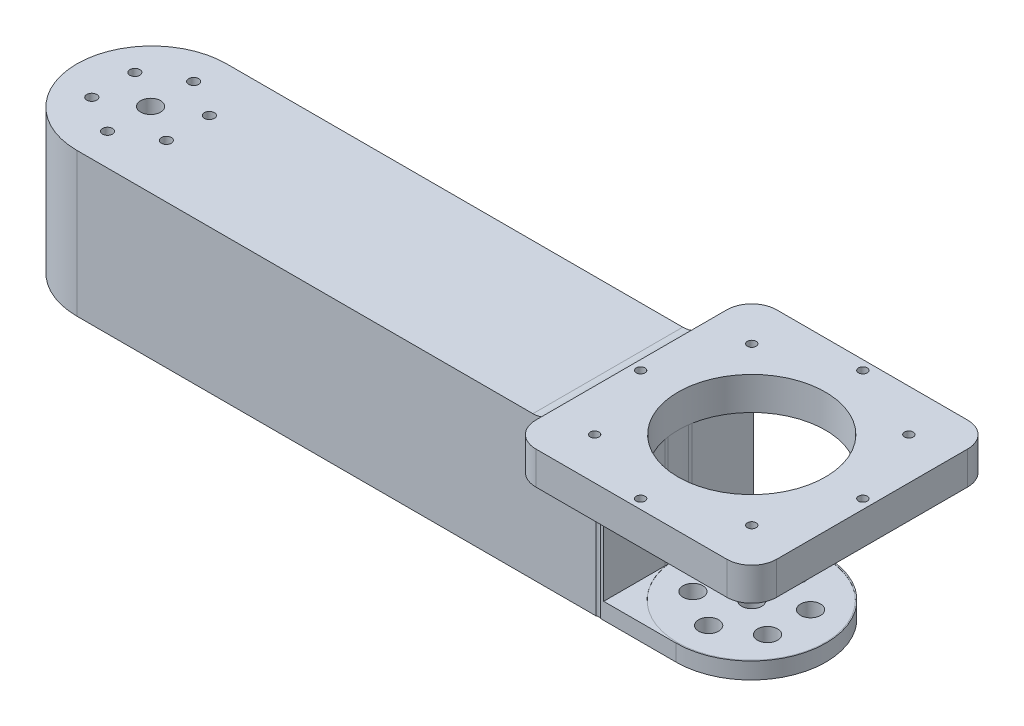
from build123d import *

# Parameters (mm, degrees)
SKETCH_1_W           = 300
SKETCH_1_H           = 60
EXTRUDE_1_DEPTH      = 57.52
FILLET_1_RADIUS      = 30
FILLET_1_LENGTH      = 57.52
SKETCH_9_W           = 60
SKETCH_9_H           = 44.32
CUT_EXTRUDE_5_DEPTH  = 59
FILLET_2_RADIUS      = 30
FILLET_2_LENGTH      = 6.6
FILLET_3_RADIUS      = 30
FILLET_3_LENGTH      = 6.6
SKETCH_10_R          = 29.5
CUT_EXTRUDE_6_DEPTH  = 51
FILLET_4_R           = 10
SKETCH_16_R          = 1.75
CUT_EXTRUDE_8_DEPTH  = 115
SKETCH_17_W          = 96.5
SKETCH_17_H          = 96.5
EXTRUDE_3_DEPTH      = 6.6
SKETCH_18_R          = 4
CUT_EXTRUDE_9_DEPTH  = 113.6
CUT_EXTRUDE_START    = -109
SKETCH_20_R          = 1.75
CUT_EXTRUDE_10_DEPTH = 109
SKETCH_21_R          = 29.5
CUT_EXTRUDE_11_DEPTH = 27
EXTRUDE_START        = -10
SKETCH_24_W          = 96.5
SKETCH_24_H          = 96.5
SKETCH_24_R          = 29.5
EXTRUDE_5_DEPTH      = 10
SKETCH_25_R          = 1.75
CUT_EXTRUDE_12_DEPTH = 28
SKETCH_26_R          = 4
CUT_EXTRUDE_13_DEPTH = 81
SKETCH_27_R          = 2
CUT_EXTRUDE_14_DEPTH = 57.52
SKETCH_28_R          = 4
CUT_EXTRUDE_15_DEPTH = 6.52
FILLET_5_R           = 10
FILLET_6_R           = 10
FILLET_7_R           = 10
FILLET_8_R           = 10
FILLET_10_R          = 10


with BuildPart() as part:
    # 草图1 → 凸台-拉伸1 (new body)
    with BuildSketch(Plane(origin=(0, 0, 0), x_dir=(1, 0, 0), z_dir=(0, 1, 0))):
        with Locations((150, -30)):
            Rectangle(SKETCH_1_W, SKETCH_1_H)
    extrude(amount=EXTRUDE_1_DEPTH)

    # 圆角1: full round fillet: the end face becomes a half cylinder, R = half its width
    fillet_1_face = Plane((0, 28.76, 30), x_dir=(0, -1, 0), z_dir=(-1, 0, 0))  # on the end face: x along it, z out of the body
    fillet_1_slab = fillet_1_face.offset(-FILLET_1_RADIUS / 2) * Box(FILLET_1_LENGTH, 2 * FILLET_1_RADIUS, FILLET_1_RADIUS, mode=Mode.PRIVATE)  # the body's end, R deep
    fillet_1_round = Plane((30, 28.76, 30), x_dir=(-1, 0, 0), z_dir=(0, -1, 0)) * Cylinder(FILLET_1_RADIUS, FILLET_1_LENGTH, mode=Mode.PRIVATE)  # its axis R under the face
    add(fillet_1_slab - fillet_1_round, mode=Mode.SUBTRACT)

    # 草图9 → 切除-拉伸5 (cut)
    with BuildSketch(Plane(origin=(300, 0, 0), x_dir=(0, 0, -1), z_dir=(1, 0, 0))):
        with Locations((-30, 28.76)):
            Rectangle(SKETCH_9_W, SKETCH_9_H)
    extrude(amount=-CUT_EXTRUDE_5_DEPTH, mode=Mode.SUBTRACT)

    # 圆角2: full round fillet: the end face becomes a half cylinder, R = half its width
    fillet_2_face = Plane((300, 54.22, 30), x_dir=(0, 1, 0), z_dir=(1, 0, 0))  # on the end face: x along it, z out of the body
    fillet_2_slab = fillet_2_face.offset(-FILLET_2_RADIUS / 2) * Box(FILLET_2_LENGTH, 2 * FILLET_2_RADIUS, FILLET_2_RADIUS, mode=Mode.PRIVATE)  # the body's end, R deep
    fillet_2_round = Plane((270, 54.22, 30), x_dir=(1, 0, 0), z_dir=(0, 1, 0)) * Cylinder(FILLET_2_RADIUS, FILLET_2_LENGTH, mode=Mode.PRIVATE)  # its axis R under the face
    add(fillet_2_slab - fillet_2_round, mode=Mode.SUBTRACT)

    # 圆角3: full round fillet: the end face becomes a half cylinder, R = half its width
    fillet_3_face = Plane((300, 3.3, 30), x_dir=(0, 1, 0), z_dir=(1, 0, 0))  # on the end face: x along it, z out of the body
    fillet_3_slab = fillet_3_face.offset(-FILLET_3_RADIUS / 2) * Box(FILLET_3_LENGTH, 2 * FILLET_3_RADIUS, FILLET_3_RADIUS, mode=Mode.PRIVATE)  # the body's end, R deep
    fillet_3_round = Plane((270, 3.3, 30), x_dir=(1, 0, 0), z_dir=(0, 1, 0)) * Cylinder(FILLET_3_RADIUS, FILLET_3_LENGTH, mode=Mode.PRIVATE)  # its axis R under the face
    add(fillet_3_slab - fillet_3_round, mode=Mode.SUBTRACT)

    # 草图10 → 切除-拉伸6 (cut)
    with BuildSketch(Plane(origin=(0, 57.52, 0), x_dir=(1, 0, 0), z_dir=(0, 1, 0))):
        with Locations(Location((270.132203493, -30.03743589, 0), (0, 0, 270))):
            Circle(SKETCH_10_R)
    extrude(amount=-CUT_EXTRUDE_6_DEPTH, mode=Mode.SUBTRACT)

    # 圆角4
    fillet_4_edges = [part.edges().sort_by_distance(p)[0] for p in [
        (241, 28.76, 34.681218791),
        (241, 28.76, 25.39365299),
    ]]
    fillet(fillet_4_edges, radius=FILLET_4_R)

    # 草图16 → 切除-拉伸8 (cut)
    with BuildSketch(Plane(origin=(0, 6.52, 0), x_dir=(1, 0, 0), z_dir=(0, 1, 0))):
        with Locations(Location((225.816101747, -30.018717945, 0), (0, 0, 90))):
            Circle(SKETCH_16_R)
    extrude(amount=CUT_EXTRUDE_8_DEPTH, mode=Mode.SUBTRACT)

    # 草图17 → 凸台-拉伸3 (add)
    with BuildSketch(Plane(origin=(0, 57.52, 0), x_dir=(1, 0, 0), z_dir=(0, 1, 0))):
        with Locations((270.316101747, -30.018717945)):
            Rectangle(SKETCH_17_W, SKETCH_17_H)
    extrude(amount=EXTRUDE_3_DEPTH)

    # 草图18 → 切除-拉伸9 (cut)
    with BuildSketch(Plane(origin=(0, 64.12, 0), x_dir=(1, 0, 0), z_dir=(0, 1, 0))):
        with Locations(Location((270.316101747, -12.768717945, 0), (0, 0, 270))):
            Circle(SKETCH_18_R)
        with Locations(Location((285.255039962, -21.393717945, 0), (0, 0, 270))):
            Circle(SKETCH_18_R)
        with Locations(Location((285.255039962, -38.643717945, 0), (0, 0, 270))):
            Circle(SKETCH_18_R)
        with Locations(Location((270.316101747, -47.268717945, 0), (0, 0, 270))):
            Circle(SKETCH_18_R)
        with Locations(Location((255.377163531, -38.643717945, 0), (0, 0, 270))):
            Circle(SKETCH_18_R)
        with Locations(Location((255.377163531, -21.393717945, 0), (0, 0, 270))):
            Circle(SKETCH_18_R)
    extrude(amount=-CUT_EXTRUDE_9_DEPTH, mode=Mode.SUBTRACT)

    # 草图20 → 切除-拉伸10 (cut)
    with BuildSketch(Plane(origin=(0, 64.12, 0), x_dir=(1, 0, 0), z_dir=(0, 1, 0)).offset(CUT_EXTRUDE_START)):
        with Locations(Location((270.316101747, 14.481282055, 0), (0, 0, 270))):
            Circle(SKETCH_20_R)
        with Locations(Location((301.782353509, 1.447533818, 0), (0, 0, 270))):
            Circle(SKETCH_20_R)
        with Locations(Location((314.816101747, -30.018717945, 0), (0, 0, 270))):
            Circle(SKETCH_20_R)
        with Locations(Location((301.782353509, -61.484969708, 0), (0, 0, 270))):
            Circle(SKETCH_20_R)
        with Locations(Location((270.316101747, -74.518717945, 0), (0, 0, 270))):
            Circle(SKETCH_20_R)
        with Locations(Location((238.849849984, -61.484969708, 0), (0, 0, 270))):
            Circle(SKETCH_20_R)
        with Locations(Location((225.816101747, -30.018717945, 0), (0, 0, 90))):
            Circle(SKETCH_20_R)
        with Locations(Location((238.849849984, 1.447533818, 0), (0, 0, 270))):
            Circle(SKETCH_20_R)
    extrude(amount=CUT_EXTRUDE_10_DEPTH, mode=Mode.SUBTRACT)

    # 草图21 → 切除-拉伸11 (cut)
    with BuildSketch(Plane(origin=(0, 64.12, 0), x_dir=(1, 0, 0), z_dir=(0, 1, 0))):
        with Locations(Location((270.316101747, -30.018717945, 0), (0, 0, 270))):
            Circle(SKETCH_21_R)
    extrude(amount=-CUT_EXTRUDE_11_DEPTH, mode=Mode.SUBTRACT)

    # 草图24 → 凸台-拉伸5 (add)
    with BuildSketch(Plane(origin=(0, 50.92, 0), x_dir=(-1, 0, 0), z_dir=(0, -1, 0)).offset(EXTRUDE_START)):
        with Locations((-270.316101747, -30.018717945)):
            Rectangle(SKETCH_24_W, SKETCH_24_H)
        with Locations(Location((-270.316101747, -30.018717945, 0), (0, 0, 270))):
            Circle(SKETCH_24_R, mode=Mode.SUBTRACT)
    extrude(amount=EXTRUDE_5_DEPTH)

    # 草图25 → 切除-拉伸12 (cut)
    with BuildSketch(Plane(origin=(0, 50.92, 0), x_dir=(-1, 0, 0), z_dir=(0, -1, 0))):
        with Locations(Location((-314.816101747, -30.018717945, 0), (0, 0, 270))):
            Circle(SKETCH_25_R)
        with Locations(Location((-301.782353509, 1.447533818, 0), (0, 0, 270))):
            Circle(SKETCH_25_R)
        with Locations(Location((-270.316101747, 14.481282055, 0), (0, 0, 270))):
            Circle(SKETCH_25_R)
        with Locations(Location((-238.849849984, 1.447533818, 0), (0, 0, 270))):
            Circle(SKETCH_25_R)
        with Locations(Location((-225.816101747, -30.018717945, 0), (0, 0, 90))):
            Circle(SKETCH_25_R)
        with Locations(Location((-238.849849984, -61.484969708, 0), (0, 0, 270))):
            Circle(SKETCH_25_R)
        with Locations(Location((-270.316101747, -74.518717945, 0), (0, 0, 270))):
            Circle(SKETCH_25_R)
        with Locations(Location((-301.782353509, -61.484969708, 0), (0, 0, 270))):
            Circle(SKETCH_25_R)
    extrude(amount=-CUT_EXTRUDE_12_DEPTH, mode=Mode.SUBTRACT)

    # 草图26 → 切除-拉伸13 (cut)
    with BuildSketch(Plane(origin=(0, 57.52, 0), x_dir=(1, 0, 0), z_dir=(0, 1, 0))):
        with Locations(Location((29.531429568, -29.988572589, 0), (0, 0, 270))):
            Circle(SKETCH_26_R)
    extrude(amount=-CUT_EXTRUDE_13_DEPTH, mode=Mode.SUBTRACT)

    # 草图27 → 切除-拉伸14 (cut)
    with BuildSketch(Plane(origin=(0, 57.52, 0), x_dir=(1, 0, 0), z_dir=(0, 1, 0))):
        with Locations(Location((29.531429568, -12.738572589, 0), (0, 0, 270))):
            Circle(SKETCH_27_R)
        with Locations(Location((44.470367783, -21.363572589, 0), (0, 0, 270))):
            Circle(SKETCH_27_R)
        with Locations(Location((44.470367783, -38.613572589, 0), (0, 0, 270))):
            Circle(SKETCH_27_R)
        with Locations(Location((29.531429568, -47.238572589, 0), (0, 0, 270))):
            Circle(SKETCH_27_R)
        with Locations(Location((14.592491352, -38.613572589, 0), (0, 0, 270))):
            Circle(SKETCH_27_R)
        with Locations(Location((14.592491352, -21.363572589, 0), (0, 0, 270))):
            Circle(SKETCH_27_R)
    extrude(amount=-CUT_EXTRUDE_14_DEPTH, mode=Mode.SUBTRACT)

    # 草图28 → 切除-拉伸15 (cut)
    with BuildSketch(Plane(origin=(0, 0, 0), x_dir=(-1, 0, 0), z_dir=(0, -1, 0))):
        with Locations(Location((-270.316101747, -30.018717945, 0), (0, 0, 90))):
            Circle(SKETCH_28_R)
    extrude(amount=-CUT_EXTRUDE_15_DEPTH, mode=Mode.SUBTRACT)

    # 圆角5
    fillet_5_edges = [part.edges().sort_by_distance(p)[0] for p in [
        (222.066101747, 57.52, -18.231282055),
    ]]
    fillet(fillet_5_edges, radius=FILLET_5_R)

    # 圆角6
    fillet_6_edges = [part.edges().sort_by_distance(p)[0] for p in [
        (318.566101747, 57.52, -18.231282055),
    ]]
    fillet(fillet_6_edges, radius=FILLET_6_R)

    # 圆角7
    fillet_7_edges = [part.edges().sort_by_distance(p)[0] for p in [
        (318.566101747, 57.52, 78.268717945),
    ]]
    fillet(fillet_7_edges, radius=FILLET_7_R)

    # 圆角8
    fillet_8_edges = [part.edges().sort_by_distance(p)[0] for p in [
        (222.066101747, 57.52, 78.268717945),
    ]]
    fillet(fillet_8_edges, radius=FILLET_8_R)

    # 圆角10
    # the kernel refuses this fillet: 10 mm, written as the material it adds along each edge
    with BuildSketch(Plane(origin=(222.066101747, 57.52, 60), x_dir=(0, 1, 0), z_dir=(0, 0, -1))) as fillet_10_piece_1:
        with BuildLine():
            CenterArc((10, -9.404254356), FILLET_10_R, 109.87687407, 70.12312593)
            Line((0, -9.404254356), (-0.2, -9.404254356))
            Line((-0.2, -9.404254356), (-0.2, 0))
            Line((-0.2, 0), (0, 0.2))
            ThreePointArc((0, 0.2), (3.3, 0.2), (6.532, 0.188085087))
            Line((6.532, 0.188085087), (6.6, 0))
        make_face()
    extrude(amount=60)


solid = part.part
